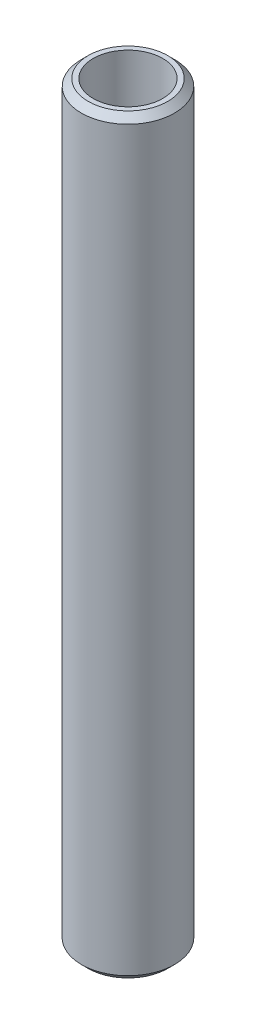
from build123d import *

# Parameters (mm, degrees)
SKETCH1_R           = 35
BOSS_EXTRUDE1_DEPTH = 564.727513189
SKETCH2_R           = 26.141241897
CUT_EXTRUDE1_DEPTH  = 567.8925508
CHAMFER1_SIZE       = 5.091195854


with BuildPart() as part:
    # Sketch1 → Boss-Extrude1 (new body)
    with BuildSketch(Plane(origin=(0, 0, 0), x_dir=(1, 0, 0), z_dir=(0, 1, 0))):
        Circle(SKETCH1_R)
    extrude(amount=BOSS_EXTRUDE1_DEPTH)

    # Sketch2 → Cut-Extrude1 (cut, through all)
    with BuildSketch(Plane(origin=(0, 0, 0), x_dir=(1, 0, 0), z_dir=(0, 1, 0))):
        Circle(SKETCH2_R)
    extrude(amount=CUT_EXTRUDE1_DEPTH, mode=Mode.SUBTRACT)

    # Chamfer1
    chamfer1_edges = [part.edges().sort_by_distance(p)[0] for p in [
        (-35, 564.727513189, 0),
        (-35, 0, 0),
    ]]
    chamfer(chamfer1_edges, length=CHAMFER1_SIZE)


solid = part.part
